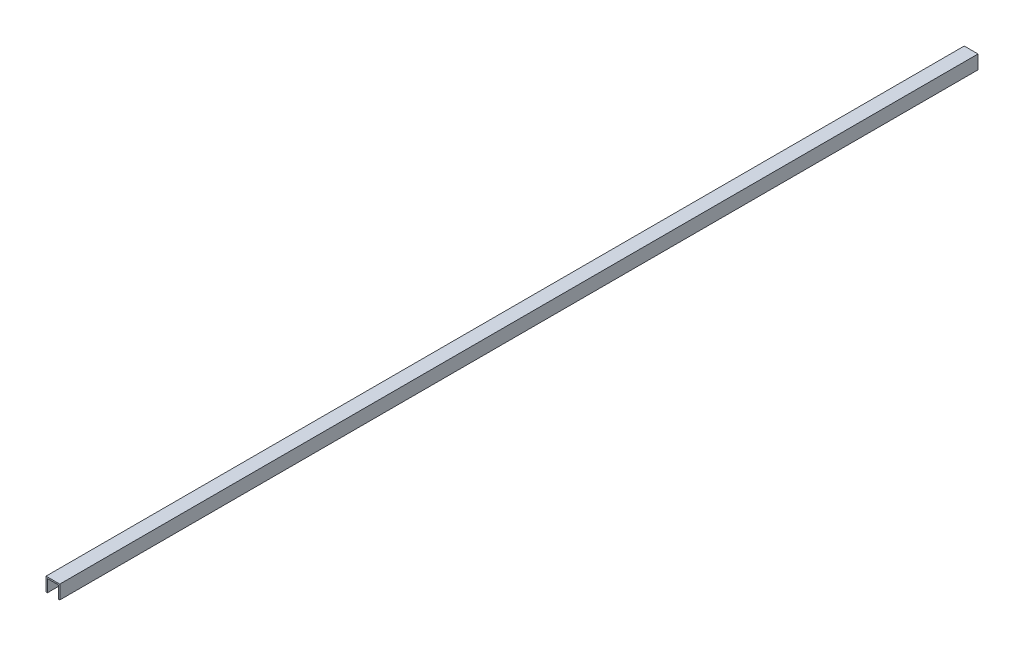
from build123d import *

# Parameters (mm, degrees)
BOSS_EXTRUDE1_DEPTH = 500


with BuildPart() as part:
    # Sketch2 → Boss-Extrude1 (new, symmetric)
    with BuildSketch(Plane.XY):
        Polygon((-6, -7.5), (-6, 6), (6, 6), (6, -7.5), (7.5, -7.5), (7.5, 7.5), (-7.5, 7.5), (-7.5, -7.5), align=None)
    extrude(amount=BOSS_EXTRUDE1_DEPTH, both=True)


solid = part.part
